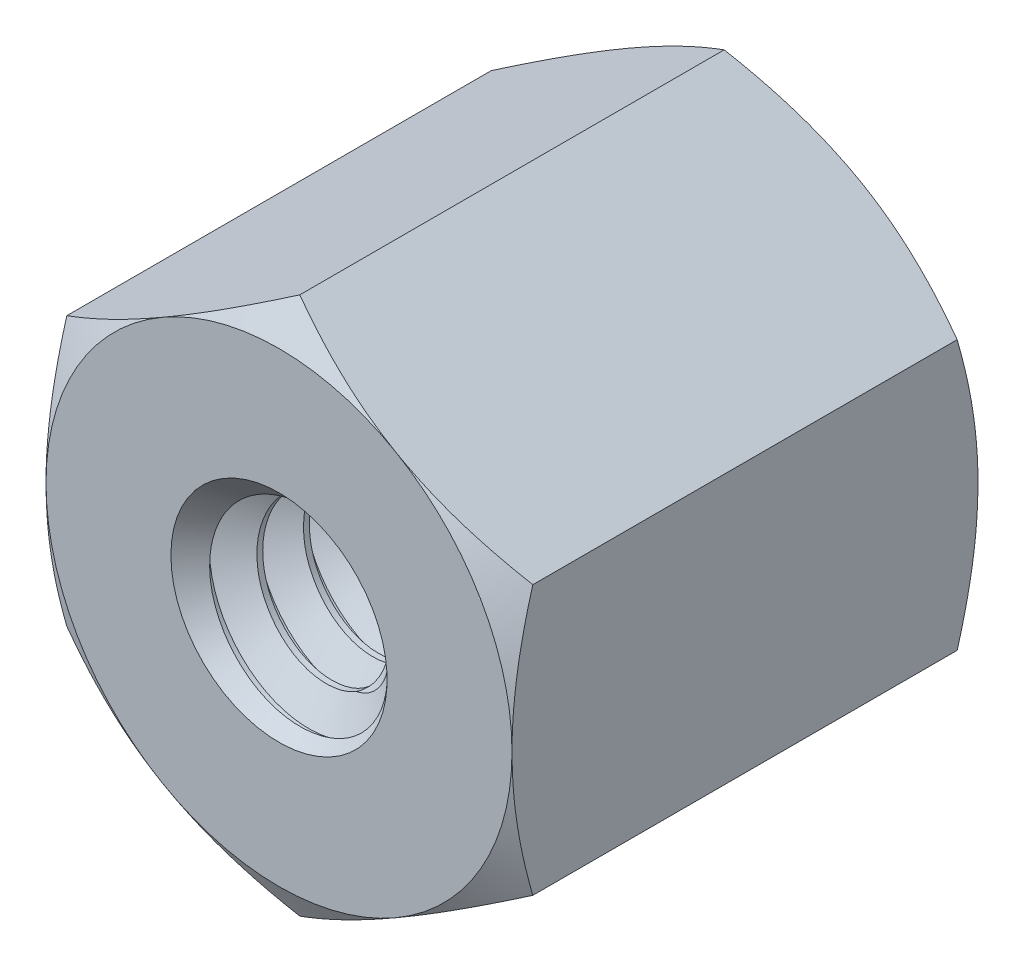
from build123d import *

# Parameters (mm, degrees)
EXTRUDE1_DEPTH          = 3.175
EXTRUDE1_DEPTH_BACK     = 3.175
SKETCH1_R               = 1.4224
SWEEP1_PITCH            = 0.635
EXTRUDE2_DEPTH          = 9.503770093
SKETCH8_OUTSIDE_W       = 43.662
SKETCH8_OUTSIDE_H       = 44.644
SKETCH8_OUTSIDE_R       = 3.175
EXTRUDE4_DEPTH          = 9.503770093
EXTRUDE4_DRAFT          = -60
MIRROR1_COPY_1_SKETCH_W = 43.662
MIRROR1_COPY_1_SKETCH_H = 44.644
MIRROR1_COPY_1_SKETCH_R = 3.175
MIRROR1_COPY_1_DEPTH    = 9.503770093
MIRROR1_COPY_1_DRAFT    = -60


with BuildPart() as part:
    # Sketch1 → Extrude1 (new, two sides: drawn at the far end of the back side and taken through both)
    with BuildSketch(Plane.XY.offset(-EXTRUDE1_DEPTH_BACK)):
        Polygon((0, 3.666174209), (-3.175, 1.833087105), (-3.175, -1.833087105), (0, -3.666174209), (3.175, -1.833087105), (3.175, 1.833087105), align=None)
        Circle(SKETCH1_R, mode=Mode.SUBTRACT)
    extrude(amount=EXTRUDE1_DEPTH + EXTRUDE1_DEPTH_BACK)

    # Sweep1: the profile of Sketch12 profile screwed along a right-hand helix of 11 turns, 6 arcs to a turn; built about Z, then put on its axis
    sweep1_z = Axis((0, 0, 0), (0, 0, 1))
    sweep1_corners = [(1.4227, 0, -0.555798205), (1.4227, 0, 0.000173205), (1.009955401, 0, -0.238125), (1.009955401, 0, -0.3175)]
    with BuildLine(mode=Mode.PRIVATE) as sweep1_profile:
        Line(sweep1_corners[0], sweep1_corners[1])
        Line(sweep1_corners[1], sweep1_corners[2])
        Line(sweep1_corners[2], sweep1_corners[3])
        Line(sweep1_corners[3], sweep1_corners[0])
    sweep1_cap = Face(sweep1_profile.wire())
    sweep1_turn_angles = [0, 30, 60, 90, 120, 150, 180, 210, 240, 270, 300, 330, 360]
    sweep1_turn_weights = [1, 0.8660254037844387, 1, 0.8660254037844387, 1, 0.8660254037844387, 1, 0.8660254037844387, 1, 0.8660254037844387, 1, 0.8660254037844387, 1]
    sweep1_turn_rails = [Edge.make_bspline([Vector(p[0], p[1], 0).rotate(sweep1_z, sweep1_turn_angles[k]) / sweep1_turn_weights[k] + Vector(0, 0, p[2] + SWEEP1_PITCH * sweep1_turn_angles[k] / 360) for k in range(13)], [0, 0, 0, 1, 1, 2, 2, 3, 3, 4, 4, 5, 5, 6, 6, 6], 2, sweep1_turn_weights) for p in sweep1_corners]
    sweep1_turn_sides = [Face.make_surface_from_curves(sweep1_turn_rails[p[0]], sweep1_turn_rails[p[1]]) for p in [(0, 1), (1, 2), (2, 3), (3, 0)]]
    sweep1 = Plane(origin=(0, 0, -3.175), x_dir=(0, 1, 0), z_dir=(0, 0, 1)) * Solid(Shell([*[p.moved(Location((0, 0, SWEEP1_PITCH * i))) for i in range(11) for p in sweep1_turn_sides], sweep1_cap, sweep1_cap.rotate(sweep1_z, 3960).moved(Location((0, 0, SWEEP1_PITCH * 3960 / 360)))]))
    add(sweep1)

    # Sketch6 → Extrude2 (cut, through all)
    with BuildSketch(Plane(origin=(0, 0, -3.175), x_dir=(-1, 0, 0), z_dir=(0, 0, -1))):
        Polygon((0, 3.666174209), (-3.175, 1.833087105), (-3.175, -1.833087105), (0, -3.666174209), (3.175, -1.833087105), (3.175, 1.833087105), align=None)
    extrude2 = extrude(amount=EXTRUDE2_DEPTH, mode=Mode.SUBTRACT)

    # Extrude3 cone 1 section (through the dimple's axis) → Extrude3 (revolve, cut)
    with BuildSketch(Plane(origin=(0, 0, -3.175), x_dir=(0, 1, 0), z_dir=(1, 0, 0))):
        Polygon((0, 0), (1.4732, 0), (0, 1.579813584), align=None)
    extrude3 = revolve(axis=Axis((0, 0, -3.175), (0, 0, 1)), mode=Mode.SUBTRACT)


with BuildPart() as extrude4_tool:
    # Sketch8 outside → Extrude4 (with draft: the straight prism first)
    with BuildSketch(Plane(origin=(0, 0, -3.175), x_dir=(-1, 0, 0), z_dir=(0, 0, -1))):
        Rectangle(SKETCH8_OUTSIDE_W, SKETCH8_OUTSIDE_H)
        Circle(SKETCH8_OUTSIDE_R, mode=Mode.SUBTRACT)
    extrude(amount=-EXTRUDE4_DEPTH)
    # Extrude4: the draft: its side faces are tilted about the plane it starts from
    extrude4_sides = [extrude4_tool.faces().sort_by_distance(p)[0] for p in [
        (0, -22.322, 1.576885047),
        (-21.831, 0, 1.576885047),
        (0, 22.322, 1.576885047),
        (21.831, 0, 1.576885047),
        (3.175, 0, 1.576885047),
    ]]
    draft(extrude4_sides, Plane(origin=(0, 0, -3.175), x_dir=(-1, 0, 0), z_dir=(0, 0, -1)), EXTRUDE4_DRAFT)


with BuildPart() as part_1:
    add(part.part)

    # Extrude4: cut by extrude4_tool
    add(extrude4_tool.part, mode=Mode.SUBTRACT)

    # Mirror1: Extrude2, Extrude3 across plane
    add(extrude2.mirror(Plane.XY), mode=Mode.SUBTRACT)
    add(extrude3.mirror(Plane.XY), mode=Mode.SUBTRACT)


with BuildPart() as mirror1_copy_1_tool:
    # Mirror1 copy 1 sketch → Mirror1 copy 1 (with draft: the straight prism first)
    with BuildSketch(Plane(origin=(0, 0, 3.175), x_dir=(-1, 0, 0), z_dir=(0, 0, 1))):
        Rectangle(MIRROR1_COPY_1_SKETCH_W, MIRROR1_COPY_1_SKETCH_H)
        Circle(MIRROR1_COPY_1_SKETCH_R, mode=Mode.SUBTRACT)
    extrude(amount=-MIRROR1_COPY_1_DEPTH)
    # Mirror1 copy 1: the draft: its side faces are tilted about the plane it starts from
    mirror1_copy_1_sides = [mirror1_copy_1_tool.faces().sort_by_distance(p)[0] for p in [
        (0, -22.322, -1.576885047),
        (-21.831, 0, -1.576885047),
        (0, 22.322, -1.576885047),
        (21.831, 0, -1.576885047),
        (3.175, 0, -1.576885047),
    ]]
    draft(mirror1_copy_1_sides, Plane(origin=(0, 0, 3.175), x_dir=(-1, 0, 0), z_dir=(0, 0, 1)), MIRROR1_COPY_1_DRAFT)


with BuildPart() as part_2:
    add(part_1.part)

    # Mirror1 copy 1: cut by mirror1_copy_1_tool
    add(mirror1_copy_1_tool.part, mode=Mode.SUBTRACT)


solid = part_2.part
